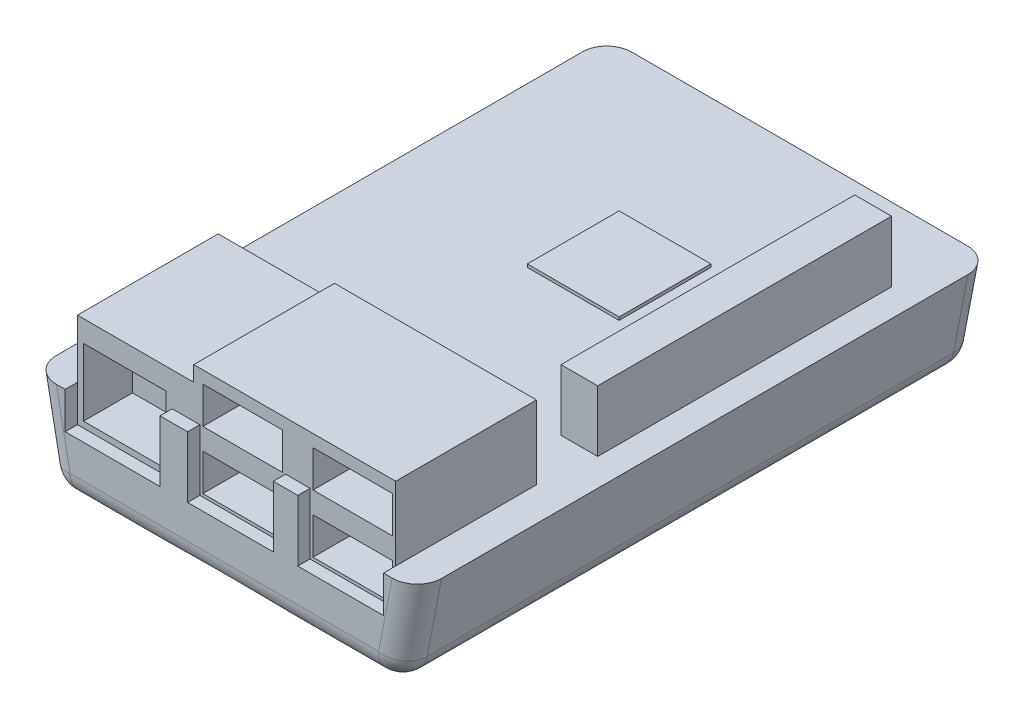
from build123d import *

# Parameters (mm, degrees)
BOSS_EXTRUDE1_DEPTH = 94
SKETCH2_W           = 14
SKETCH2_H           = 14
CUT_EXTRUDE1_DEPTH  = 5
SKETCH3_W           = 52
SKETCH3_H           = 12
BOSS_EXTRUDE2_DEPTH = 25
SKETCH4_W           = 6
SKETCH4_H           = 48
BOSS_EXTRUDE3_DEPTH = 10
SKETCH5_W           = 13.5
SKETCH5_H           = 11
SKETCH5_W_2         = 13
SKETCH5_H_2         = 6
CUT_EXTRUDE2_DEPTH  = 10
CUT_EXTRUDE3_DEPTH  = 2
SKETCH7_W           = 19
SKETCH7_H           = 2.5
CUT_EXTRUDE4_DEPTH  = 102.056914657
SKETCH8_R           = 4
CUT_EXTRUDE5_DEPTH  = 10
BOSS_EXTRUDE5_DEPTH = 2
FILLET2_R           = 4
FILLET3_R           = 4
SKETCH10_W          = 15
SKETCH10_H          = 15
BOSS_EXTRUDE6_DEPTH = 0.5


# Some blends are built 0.0001 mm under size
with BuildPart() as part:
    # Sketch1 → Boss-Extrude1 (new body)
    with BuildSketch(Plane.XY):
        with BuildLine():
            Line((-31.5, 15.5), (-28.5, 0))
            Line((-28.5, 0), (-21, 0))
            ThreePointArc((-21, 0), (0, 1.776625594), (21, 0))
            Line((21, 0), (28.5, 0))
            Line((28.5, 0), (31.5, 15.5))
            Line((31.5, 15.5), (-31.5, 15.5))
        make_face()
    extrude(amount=BOSS_EXTRUDE1_DEPTH)

    # Sketch2 → Cut-Extrude1 (cut)
    with BuildSketch(Plane(origin=(0, 0, 0), x_dir=(-1, 0, 0), z_dir=(0, 0, -1))):
        Rectangle(SKETCH2_W, SKETCH2_H)
    extrude(amount=-CUT_EXTRUDE1_DEPTH, mode=Mode.SUBTRACT)

    # Sketch3 → Boss-Extrude2 (add)
    with BuildSketch(Plane.XY.offset(94)):
        with Locations((0, 21.5)):
            Rectangle(SKETCH3_W, SKETCH3_H)
    extrude(amount=-BOSS_EXTRUDE2_DEPTH)

    # Sketch4 → Boss-Extrude3 (add)
    with BuildSketch(Plane(origin=(0, 15.5, 0), x_dir=(1, 0, 0), z_dir=(0, 1, 0))):
        with Locations((24, -36)):
            Rectangle(SKETCH4_W, SKETCH4_H)
    extrude(amount=BOSS_EXTRUDE3_DEPTH)

    # Sketch5 → Cut-Extrude2 (cut)
    with BuildSketch(Plane.XY.offset(94)):
        with Locations((-18.25, 16)):
            Rectangle(SKETCH5_W, SKETCH5_H)
        with Locations((1, 22.5)):
            Rectangle(SKETCH5_W_2, SKETCH5_H_2)
        with Locations((19, 22.5)):
            Rectangle(SKETCH5_W_2, SKETCH5_H_2)
        with Locations((1, 13)):
            Rectangle(SKETCH5_W_2, SKETCH5_H_2)
        with Locations((19, 13)):
            Rectangle(SKETCH5_W_2, SKETCH5_H_2)
    extrude(amount=-CUT_EXTRUDE2_DEPTH, mode=Mode.SUBTRACT)

    # Sketch6 → Cut-Extrude3 (cut)
    with BuildSketch(Plane.XY.offset(94)):
        Polygon((-26, 15.5), (-26, 9.5), (-10.5, 9.5), (-10.5, 19.5), (-6, 19.5), (-6, 9.5), (8, 9.5), (8, 19.5), (12, 19.5), (12, 9.5), (26, 9.5), (26, 33.954249065), (-26, 33.954249065), align=None)
    extrude(amount=-CUT_EXTRUDE3_DEPTH, mode=Mode.SUBTRACT)

    # Sketch7 → Cut-Extrude4 (cut, through all)
    with BuildSketch(Plane.XY.offset(92)):
        with Locations((-16.5, 26.25)):
            Rectangle(SKETCH7_W, SKETCH7_H)
    extrude(amount=-CUT_EXTRUDE4_DEPTH, mode=Mode.SUBTRACT)

    # Sketch8 → Cut-Extrude5 (cut)
    with BuildSketch(Plane.XZ):
        with BuildLine():
            ThreePointArc((-21, 57.872983346), (-23.16227766, 56.449489743), (-24, 54))
            ThreePointArc((-24, 54), (-23.16227766, 51.550510257), (-21, 50.127016654))
            Line((-21, 50.127016654), (-21, 57.872983346))
        make_face()
        with BuildLine():
            ThreePointArc((-16, 54), (-17.550510257, 57.16227766), (-21, 57.872983346))
            Line((-21, 57.872983346), (-21, 50.127016654))
            ThreePointArc((-21, 50.127016654), (-17.550510257, 50.83772234), (-16, 54))
        make_face()
        with BuildLine():
            ThreePointArc((-21, 43.872983346), (-23.16227766, 42.449489743), (-24, 40))
            ThreePointArc((-24, 40), (-23.16227766, 37.550510257), (-21, 36.127016654))
            Line((-21, 36.127016654), (-21, 43.872983346))
        make_face()
        with BuildLine():
            ThreePointArc((-16, 40), (-17.550510257, 43.16227766), (-21, 43.872983346))
            Line((-21, 43.872983346), (-21, 36.127016654))
            ThreePointArc((-21, 36.127016654), (-17.550510257, 36.83772234), (-16, 40))
        make_face()
        with BuildLine():
            ThreePointArc((-16, 54), (-17.550510257, 50.83772234), (-21, 50.127016654))
            Line((-21, 50.127016654), (-21, 43.872983346))
            ThreePointArc((-21, 43.872983346), (-17.550510257, 43.16227766), (-16, 40))
            Line((-16, 40), (-16, 54))
        make_face()
        with BuildLine():
            ThreePointArc((-21, 50.127016654), (-23.16227766, 51.550510257), (-24, 54))
            Line((-24, 54), (-24, 40))
            ThreePointArc((-24, 40), (-23.16227766, 42.449489743), (-21, 43.872983346))
            Line((-21, 43.872983346), (-21, 50.127016654))
        make_face()
        with Locations((20, 54)):
            Circle(SKETCH8_R)
        with BuildLine():
            Line((24, 40), (24, 54))
            ThreePointArc((24, 54), (20, 50), (16, 54))
            Line((16, 54), (16, 40))
            ThreePointArc((16, 40), (20, 44), (24, 40))
        make_face()
        with Locations((20, 40)):
            Circle(SKETCH8_R)
    extrude(amount=-CUT_EXTRUDE5_DEPTH, mode=Mode.SUBTRACT)

    # Sketch9 → Boss-Extrude5 (add)
    with BuildSketch(Plane.XZ):
        with BuildLine():
            Line((-15, 40), (-15, 54))
            ThreePointArc((-15, 54), (-16.83772234, 57.872983346), (-21, 58.898979486))
            Line((-21, 58.898979486), (-21, 57.872983346))
            ThreePointArc((-21, 57.872983346), (-17.550510257, 57.16227766), (-16, 54))
            Line((-16, 54), (-16, 44.75))
            Line((-16, 44.75), (-18.25, 44.75))
            Line((-18.25, 44.75), (-18.25, 40))
            ThreePointArc((-18.25, 40), (-20, 38.25), (-21.75, 40))
            Line((-21.75, 40), (-21.75, 44.75))
            Line((-21.75, 44.75), (-25, 44.75))
            Line((-25, 44.75), (-25, 40))
            ThreePointArc((-25, 40), (-20, 35), (-15, 40))
        make_face()
        with BuildLine():
            Line((16, 44.75), (18.25, 44.75))
            Line((18.25, 44.75), (18.25, 40))
            ThreePointArc((18.25, 40), (20, 38.25), (21.75, 40))
            Line((21.75, 40), (21.75, 44.75))
            Line((21.75, 44.75), (25, 44.75))
            Line((25, 44.75), (25, 40))
            ThreePointArc((25, 40), (20, 35), (15, 40))
            Line((15, 40), (15, 54))
            ThreePointArc((15, 54), (16.83772234, 57.872983346), (21, 58.898979486))
            Line((21, 58.898979486), (21, 57.872983346))
            ThreePointArc((21, 57.872983346), (17.550510257, 57.16227766), (16, 54))
            Line((16, 54), (16, 44.75))
        make_face()
    extrude(amount=-BOSS_EXTRUDE5_DEPTH)

    # Fillet2
    fillet2_edges = [part.edges().sort_by_distance(p)[0] for p in [
        (-28.5, 0, 47),
        (28.5, 0, 47),
    ]]
    fillet(fillet2_edges, radius=FILLET2_R)

    # Fillet3
    fillet3_edges = [part.edges().sort_by_distance(p)[0] for p in [
        (30.313539907, 9.369956187, 0),
        (27.745510401, 0.914521876, 0),
        (23.099980206, 0, 0),
    ]]
    fillet(fillet3_edges, radius=FILLET3_R)
    fillet3_2_edges = [part.edges().sort_by_distance(p)[0] for p in [
        (-30.313539907, 9.369956187, 0),
        (-27.745510401, 0.914521876, 0),
        (-23.099980206, 0, 0),
    ]]
    fillet(fillet3_2_edges, radius=FILLET3_R)
    # the kernel refuses this fillet: 4 mm, written as the material it takes off along each edge
    with BuildSketch(Plane(origin=(29.127079814, 3.239912374, 94), x_dir=(0, 0, -1), z_dir=(0.19002190656586074, 0.9817798505902814, 0))) as fillet3_3_piece_1:
        with BuildLine():
            CenterArc((FILLET3_R, FILLET3_R), FILLET3_R, 180, 90)
            Line((0, FILLET3_R), (-FILLET3_R * 0.02, FILLET3_R))
            Line((-FILLET3_R * 0.02, FILLET3_R), (-FILLET3_R * 0.02, -FILLET3_R * 0.02))
            Line((-FILLET3_R * 0.02, -FILLET3_R * 0.02), (FILLET3_R, -FILLET3_R * 0.02))
            Line((FILLET3_R, -FILLET3_R * 0.02), (FILLET3_R, 0))
        make_face()
    extrude(amount=22.487613816, mode=Mode.SUBTRACT)
    with BuildSketch(Plane(origin=(25.199960412, 4, 94), x_dir=(0, -1, 0), z_dir=(-1, 0, 0))) as fillet3_3_piece_2:
        with BuildLine():
            CenterArc((4 - FILLET3_R, -FILLET3_R), FILLET3_R, 0, 90)
            Line((4, -FILLET3_R), (4 + FILLET3_R * 0.02, -FILLET3_R))
            Line((4 + FILLET3_R * 0.02, -FILLET3_R), (4 + FILLET3_R * 0.02, 0))
            Line((4 + FILLET3_R * 0.02, 0), (4, FILLET3_R * 0.02))
            Line((4, FILLET3_R * 0.02), (4 - FILLET3_R, FILLET3_R * 0.02))
            Line((4 - FILLET3_R, FILLET3_R * 0.02), (4 - FILLET3_R, 0))
        make_face()
    revolve(axis=Axis((25.199960412, 4, 94), (0, 0, 1)), revolution_arc=79.045937357, mode=Mode.SUBTRACT)
    with BuildSketch(Plane(origin=(11, 0, 94), x_dir=(0, 1, 0), z_dir=(1, 0, 0))) as fillet3_3_piece_3:
        with BuildLine():
            CenterArc((FILLET3_R, -FILLET3_R), FILLET3_R, 90, 90)
            Line((0, -FILLET3_R), (-FILLET3_R * 0.02, -FILLET3_R))
            Line((-FILLET3_R * 0.02, -FILLET3_R), (-FILLET3_R * 0.02, FILLET3_R * 0.02))
            Line((-FILLET3_R * 0.02, FILLET3_R * 0.02), (FILLET3_R, FILLET3_R * 0.02))
            Line((FILLET3_R, FILLET3_R * 0.02), (FILLET3_R, 0))
        make_face()
    extrude(amount=14.199960412, mode=Mode.SUBTRACT)
    fillet3_4_edges = [part.edges().sort_by_distance(p)[0] for p in [
        (-30.313539907, 9.369956187, 94),
        (-27.745510401, 0.914521876, 94),
        (-23.099980206, 0, 94),
    ]]
    fillet(fillet3_4_edges, radius=FILLET3_R - 0.0001)  # a hair under: the kernel refuses the full size

    # Sketch10 → Boss-Extrude6 (add)
    with BuildSketch(Plane(origin=(0, 15.5, 0), x_dir=(1, 0, 0), z_dir=(0, 1, 0))):
        with Locations((2, -31.5)):
            Rectangle(SKETCH10_W, SKETCH10_H)
    extrude(amount=BOSS_EXTRUDE6_DEPTH)


solid = part.part
